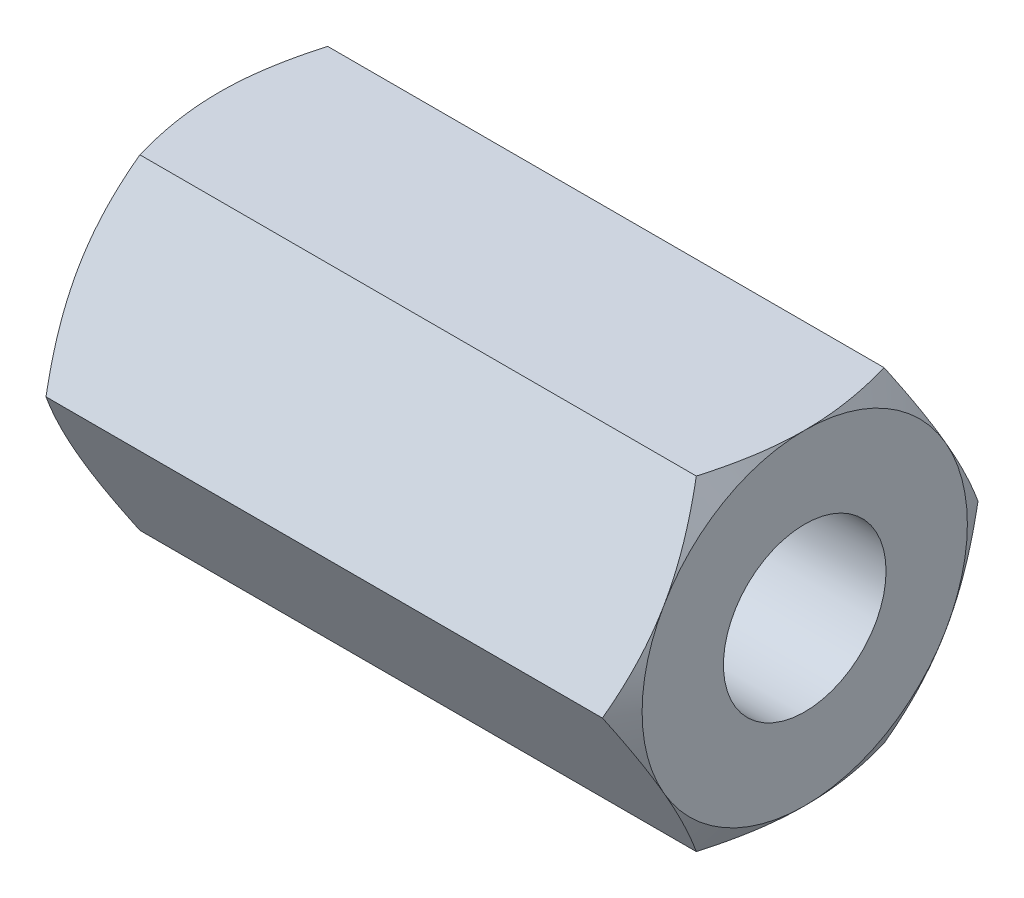
from build123d import *

# Parameters (mm, degrees)
SKETCH1_R      = 2.5
EXTRUDE1_DEPTH = 9


# Read off the part's stored shape, not the designer's step: Cut-Extrude1
with BuildPart() as part:
    # Sketch1 → Extrude1 (new, symmetric)
    with BuildSketch(Plane(origin=(0, 0, 0), x_dir=(0, 0, -1), z_dir=(1, 0, 0))):
        Polygon((5.773502692, 0), (2.886751346, 5), (-2.886751346, 5), (-5.773502692, 0), (-2.886751346, -5), (2.886751346, -5), align=None)
        Circle(SKETCH1_R, mode=Mode.SUBTRACT)
    extrude(amount=EXTRUDE1_DEPTH, both=True)

    # Cut-Extrude1 outline → Cut-Extrude1 (revolve, cut)
    with BuildSketch(Plane.YX):
        Polygon((5.773502692, 9.000000845), (4.99999886, 9.000000845), (5.773502688, 8.553418015), align=None)
    cut_extrude1 = revolve(axis=Axis((0, 0, 0), (1, 0, 0)), mode=Mode.SUBTRACT)

    # Mirror1: Cut-Extrude1 across plane
    add(cut_extrude1.mirror(Plane(origin=(0, 0, 0), x_dir=(0, 0, 1), z_dir=(1, 0, 0))), mode=Mode.SUBTRACT)


solid = part.part
